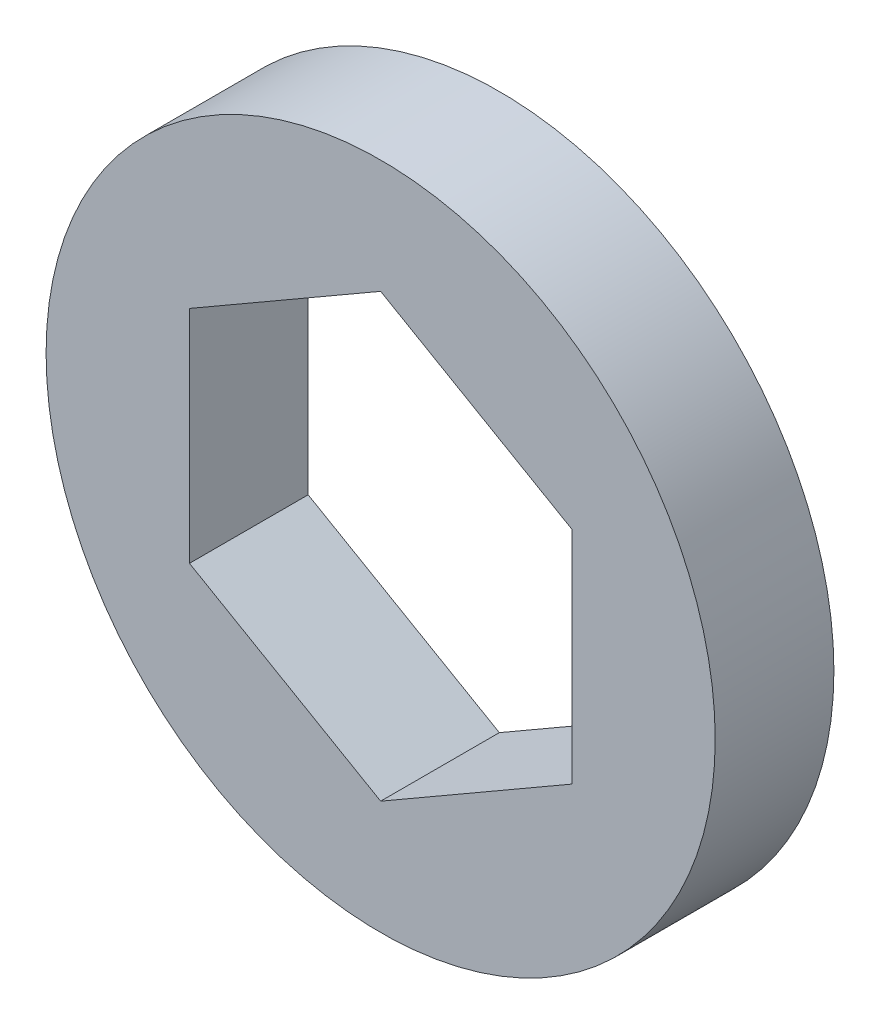
from build123d import *

# Parameters (mm, degrees)
SKETCH1_R           = 11.1125
BOSS_EXTRUDE1_DEPTH = 3.942588


with BuildPart() as part:
    # Sketch1 → Boss-Extrude1 (new body)
    with BuildSketch(Plane.XY):
        Circle(SKETCH1_R)
        Polygon((0, 7.332348419), (-6.35, 3.666174209), (-6.35, -3.666174209), (0, -7.332348419), (6.35, -3.666174209), (6.35, 3.666174209), align=None, mode=Mode.SUBTRACT)
    extrude(amount=BOSS_EXTRUDE1_DEPTH)


solid = part.part
